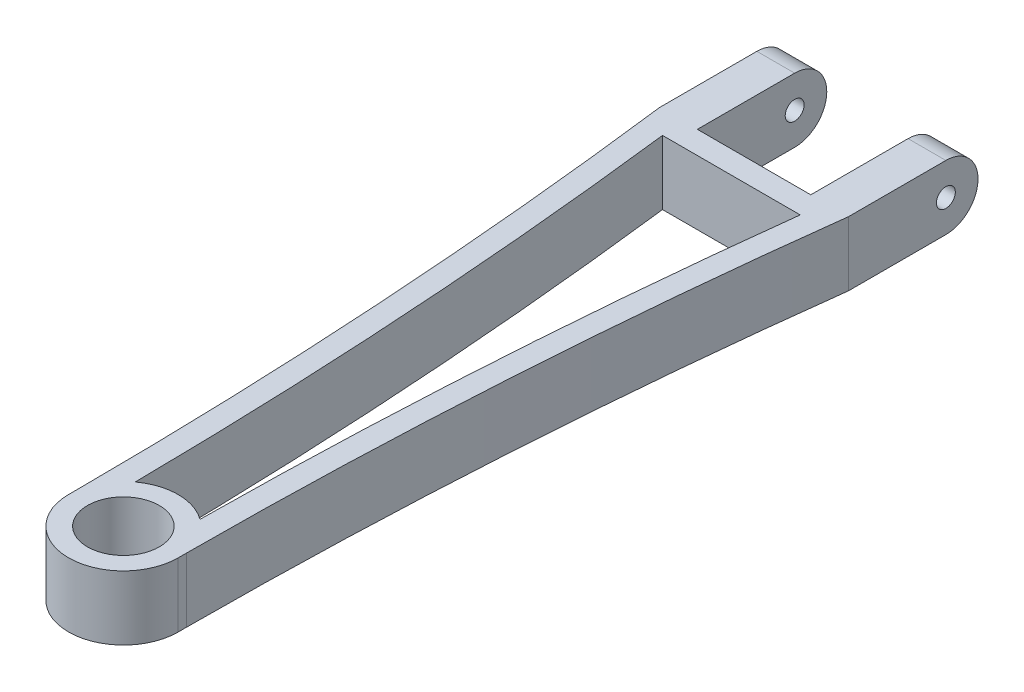
from build123d import *

# Parameters (mm, degrees)
SKETCH1_R               = 12.065
BOSS_EXTRUDE1_DEPTH     = 10.795
SKETCH5_W               = 38.1
SKETCH5_H               = 21.59
BOSS_EXTRUDE2_DEPTH     = 130.488454496
CUT_EXTRUDE2_DEPTH      = 288.61614995
CUT_EXTRUDE2_DEPTH_BACK = 76.454
SKETCH9_W               = 12.7
SKETCH9_H               = 21.59
BOSS_EXTRUDE4_DEPTH     = 117.602
CUT_EXTRUDE3_DEPTH      = 275.951363024
CUT_EXTRUDE3_DEPTH_BACK = 275.951363024
SKETCH6_4_R             = 3.175
CUT_EXTRUDE4_DEPTH      = 259.252608458
CUT_EXTRUDE8_DEPTH      = 259.252608458
CUT_EXTRUDE8_DEPTH_BACK = 259.252608458


with BuildPart() as part:
    # Sketch1 → Boss-Extrude1 (new, symmetric)
    with BuildSketch(Plane(origin=(0, 0, 0), x_dir=(1, 0, 0), z_dir=(0, 1, 0))):
        with BuildLine():
            Line((-31.75, 152.4), (31.75, 152.4))
            ThreePointArc((31.75, 152.4), (21.755106695, 76.491146914), (18.415, 0))
            ThreePointArc((18.415, 0), (0, -18.415), (-18.415, 0))
            ThreePointArc((-18.415, 0), (-21.755106695, 76.491146914), (-31.75, 152.4))
        make_face()
        Circle(SKETCH1_R, mode=Mode.SUBTRACT)
    extrude(amount=BOSS_EXTRUDE1_DEPTH, both=True)

    # Sketch5 → Boss-Extrude2 (add)
    with BuildSketch(Plane(origin=(0, 0, -152.4), x_dir=(-1, 0, 0), z_dir=(0, 0, -1))):
        Rectangle(SKETCH5_W, SKETCH5_H)
    extrude(amount=BOSS_EXTRUDE2_DEPTH)

    # Sketch6<3> → Cut-Extrude2 (cut, two sides: drawn at the far end of the back side and taken through both)
    with BuildSketch(Plane(origin=(19.05, 0, 0), x_dir=(0, 0, -1), z_dir=(1, 0, 0)).offset(-CUT_EXTRUDE2_DEPTH_BACK)):
        Polygon((211.893055705, 10.795), (213.781935951, -10.795), (282.888454496, -10.795), (282.888454496, 10.795), align=None)
    extrude(amount=CUT_EXTRUDE2_DEPTH + CUT_EXTRUDE2_DEPTH_BACK, mode=Mode.SUBTRACT)

    # Sketch9 → Boss-Extrude4 (add)
    with BuildSketch(Plane(origin=(0, 0, -152.4), x_dir=(-1, 0, 0), z_dir=(0, 0, -1))):
        with Locations((25.4, 0)):
            Rectangle(SKETCH9_W, SKETCH9_H)
        with Locations((-25.4, 0)):
            Rectangle(SKETCH9_W, SKETCH9_H)
    extrude(amount=BOSS_EXTRUDE4_DEPTH)

    # Sketch6<4> → Cut-Extrude3 (cut, two sides: drawn at the far end of the back side and taken through both)
    with BuildSketch(Plane(origin=(19.05, 0, 0), x_dir=(0, 0, -1), z_dir=(1, 0, 0)).offset(-CUT_EXTRUDE3_DEPTH_BACK)):
        with BuildLine():
            Line((282.888454496, 10.795), (244.587495828, 10.795))
            ThreePointArc((244.587495828, 10.795), (255.382495828, 0), (244.587495828, -10.795))
            Line((244.587495828, -10.795), (282.888454496, -10.795))
            Line((282.888454496, -10.795), (282.888454496, 10.795))
        make_face()
        with Locations((244.587495828, 0)):
            Circle(SKETCH6_4_R)
    extrude(amount=CUT_EXTRUDE3_DEPTH + CUT_EXTRUDE3_DEPTH_BACK, mode=Mode.SUBTRACT)

    # Sketch10 → Cut-Extrude4 (cut, through all)
    with BuildSketch(Plane(origin=(0, 10.795, 0), x_dir=(1, 0, 0), z_dir=(0, 1, 0))):
        with BuildLine():
            Line((-31.75, 211.893055705), (-31.75, 0))
            Line((-31.75, 0), (-18.415, 0))
            ThreePointArc((-18.415, 0), (-21.792855317, 106.153554042), (-31.75, 211.893055705))
        make_face()
        with BuildLine():
            Line((31.75, 0), (18.415, 0))
            ThreePointArc((18.415, 0), (21.792855317, 106.153554042), (31.75, 211.893055705))
            Line((31.75, 211.893055705), (31.75, 0))
        make_face()
    extrude(amount=-CUT_EXTRUDE4_DEPTH, mode=Mode.SUBTRACT)

    # Sketch12 → Cut-Extrude8 (cut, two sides: drawn at the far end of the back side and taken through both)
    with BuildSketch(Plane(origin=(0, 10.795, 0), x_dir=(1, 0, 0), z_dir=(0, 1, 0)).offset(-CUT_EXTRUDE8_DEPTH_BACK)):
        with BuildLine():
            ThreePointArc((10.870664384, 14.864080222), (14.386182734, 109.737999948), (23.135053878, 204.273055705))
            Line((23.135053878, 204.273055705), (-23.135053878, 204.273055705))
            ThreePointArc((-23.135053878, 204.273055705), (-14.386182734, 109.737999948), (-10.870664384, 14.864080222))
            ThreePointArc((-10.870664384, 14.864080222), (0, 18.415), (10.870664384, 14.864080222))
        make_face()
    extrude(amount=CUT_EXTRUDE8_DEPTH + CUT_EXTRUDE8_DEPTH_BACK, mode=Mode.SUBTRACT)


solid = part.part
